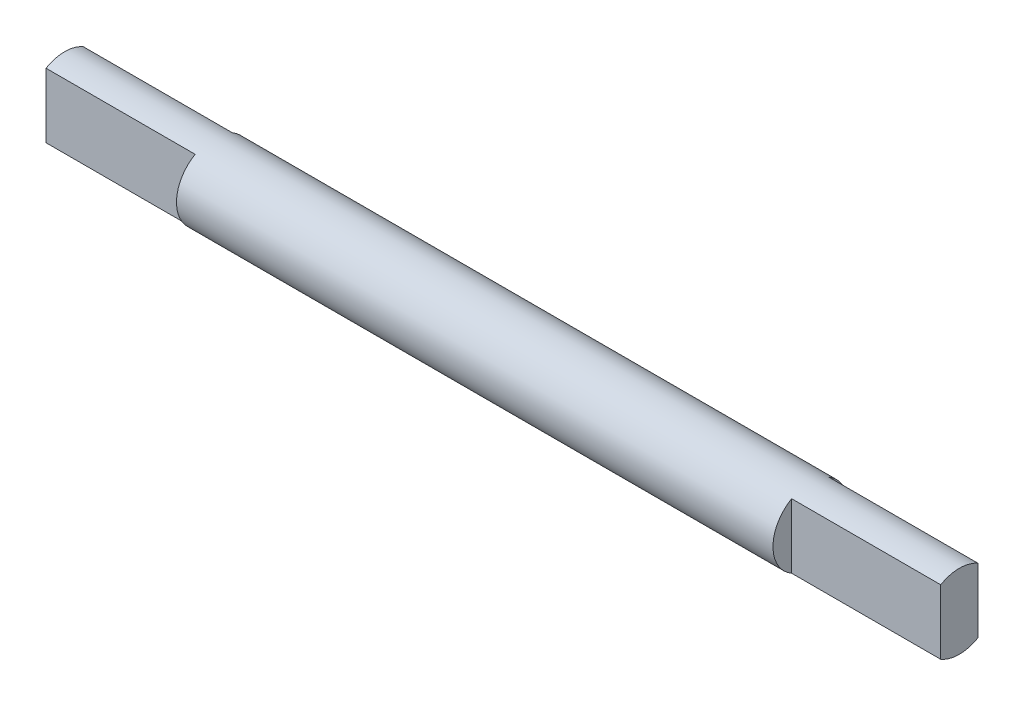
from build123d import *

# Parameters (mm, degrees)
BOSS_EXTRUDE1_DEPTH      = 279.4
BOSS_EXTRUDE1_DEPTH_BACK = 25.4
SKETCH3_R                = 12.7
CUT_EXTRUDE1_DEPTH       = 280.9766776
CUT_EXTRUDE1_DEPTH_BACK  = 280.9766776
SKETCH4_W                = 50.8
SKETCH4_H                = 6.35
CUT_EXTRUDE2_DEPTH       = 280.9766776
CUT_EXTRUDE2_DEPTH_BACK  = 280.9766776
SKETCH6_W                = 50.8
SKETCH6_H                = 6.35


with BuildPart() as part:
    # Sketch3 → Boss-Extrude1 (new, two sides: drawn at the far end of the back side and taken through both)
    with BuildSketch(Plane(origin=(0, 0, 0), x_dir=(0, 0, -1), z_dir=(1, 0, 0)).offset(-BOSS_EXTRUDE1_DEPTH_BACK)):
        Circle(SKETCH3_R)
    extrude(amount=BOSS_EXTRUDE1_DEPTH + BOSS_EXTRUDE1_DEPTH_BACK)

    # Sketch4 → Cut-Extrude1 (cut, two sides: drawn at the far end of the back side and taken through both)
    with BuildSketch(Plane(origin=(0, 0, 0), x_dir=(1, 0, 0), z_dir=(0, 1, 0)).offset(-CUT_EXTRUDE1_DEPTH_BACK)):
        with Locations((0, 9.525)):
            Rectangle(SKETCH4_W, SKETCH4_H)
        with Locations((0, -9.525)):
            Rectangle(SKETCH4_W, SKETCH4_H)
    extrude(amount=CUT_EXTRUDE1_DEPTH + CUT_EXTRUDE1_DEPTH_BACK, mode=Mode.SUBTRACT)

    # Sketch6 → Cut-Extrude2 (cut, two sides: drawn at the far end of the back side and taken through both)
    with BuildSketch(Plane(origin=(0, 0, 0), x_dir=(1, 0, 0), z_dir=(0, 1, 0)).offset(-CUT_EXTRUDE2_DEPTH_BACK)):
        with Locations((254, -9.525)):
            Rectangle(SKETCH6_W, SKETCH6_H)
        with Locations((254, 9.525)):
            Rectangle(SKETCH6_W, SKETCH6_H)
    extrude(amount=CUT_EXTRUDE2_DEPTH + CUT_EXTRUDE2_DEPTH_BACK, mode=Mode.SUBTRACT)


solid = part.part
